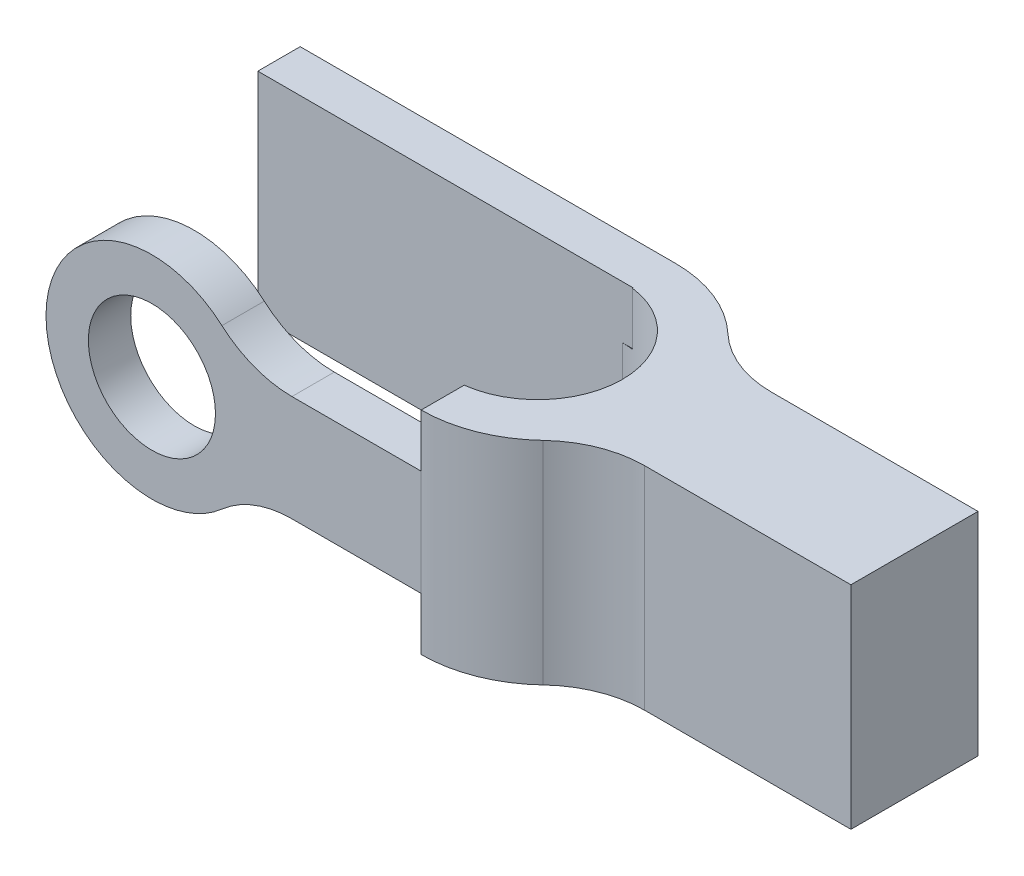
from build123d import *

# Parameters (mm, degrees)
SKETCH1_W              = 250
SKETCH1_H              = 120
BOSS_EXTRUDE1_DEPTH    = 100
CUT_EXTRUDE1_DEPTH     = 100
SKETCH5_W              = 20
SKETCH5_H              = 100
BOSS_EXTRUDE2_DEPTH    = 100
SKETCH6_W              = 20
SKETCH6_H              = 100
BOSS_EXTRUDE3_DEPTH    = 100
CUT_EXTRUDE2_START     = -100
CUT_EXTRUDE2_OUTLINE_R = 30
CUT_EXTRUDE2_DEPTH     = 100


# Read off the part's stored shape, not the designer's step: Cut-Extrude2
with BuildPart() as part:
    # Sketch1 → Boss-Extrude1 (new body)
    with BuildSketch(Plane(origin=(0, 0, 0), x_dir=(1, 0, 0), z_dir=(0, 1, 0))):
        with Locations((-125, 60)):
            Rectangle(SKETCH1_W, SKETCH1_H)
    extrude(amount=BOSS_EXTRUDE1_DEPTH)

    # Sketch2 → Cut-Extrude1 (cut)
    with BuildSketch(Plane(origin=(0, 100, 0), x_dir=(1, 0, 0), z_dir=(0, 1, 0))):
        with BuildLine():
            Line((-137.886107131, 60), (-250, 60))
            Line((-250, 60), (-250, 20))
            Line((-250, 20), (-217.607466681, 20))
            Line((-217.607466681, 20), (-177.886107131, 20))
            ThreePointArc((-177.886107131, 20), (-149.601835883, 31.715728753), (-137.886107131, 60))
        make_face()
        with BuildLine():
            Line((-250, 100), (-250, 60))
            Line((-250, 60), (-137.886107131, 60))
            ThreePointArc((-137.886107131, 60), (-149.601835883, 88.284271247), (-177.886107131, 100))
            Line((-177.886107131, 100), (-217.607466681, 100))
            Line((-217.607466681, 100), (-250, 100))
        make_face()
        with BuildLine():
            Line((0, 0), (0, 30))
            Line((0, 30), (-97.387762778, 30))
            ThreePointArc((-97.387762778, 30), (-115.851486425, 26.466018864), (-131.705192029, 16.363636364))
            ThreePointArc((-131.705192029, 16.363636364), (-150.729638754, 4.240777363), (-172.886107131, 0))
            Line((-172.886107131, 0), (0, 0))
        make_face()
        with BuildLine():
            Line((-97.387762778, 90), (0, 90))
            Line((0, 90), (0, 120))
            Line((0, 120), (-172.886107131, 120))
            ThreePointArc((-172.886107131, 120), (-150.729638754, 115.759222637), (-131.705192029, 103.636363636))
            ThreePointArc((-131.705192029, 103.636363636), (-115.851486425, 93.533981136), (-97.387762778, 90))
        make_face()
    extrude(amount=-CUT_EXTRUDE1_DEPTH, mode=Mode.SUBTRACT)

    # Sketch5 → Boss-Extrude2 (add)
    with BuildSketch(Plane.ZY.offset(250)):
        with Locations((-110, 50)):
            Rectangle(SKETCH5_W, SKETCH5_H)
    extrude(amount=BOSS_EXTRUDE2_DEPTH)

    # Sketch6 → Boss-Extrude3 (add)
    with BuildSketch(Plane.ZY.offset(250)):
        with Locations((-10, 50)):
            Rectangle(SKETCH6_W, SKETCH6_H)
    extrude(amount=BOSS_EXTRUDE3_DEPTH)

    # Cut-Extrude2 outline → Cut-Extrude2 (cut)
    with BuildSketch(Plane.XY.offset(CUT_EXTRUDE2_START)):
        with BuildLine():
            ThreePointArc((-266.908391633, 12.482609105), (-281.440890736, 3.537211244), (-298.135255344, 0))
            Line((-298.135255344, 0), (-172.886107131, 0))
            Line((-172.886107131, 0), (-172.886107131, 25))
            Line((-172.886107131, 25), (-233.816791268, 25))
            ThreePointArc((-233.816791268, 25), (-251.506753743, 21.766069191), (-266.908391633, 12.482609105))
        make_face()
        with BuildLine():
            Line((-350, 100), (-350, 50))
            ThreePointArc((-350, 50), (-320.568029043, 95.538875256), (-266.947820205, 87.482618173))
            ThreePointArc((-266.947820205, 87.482618173), (-251.561022849, 78.224637407), (-233.895648402, 75))
            Line((-233.895648402, 75), (-172.886107131, 75))
            Line((-172.886107131, 75), (-172.886107131, 100))
            Line((-172.886107131, 100), (-350, 100))
        make_face()
        with BuildLine():
            ThreePointArc((-301.864744656, 0), (-335.996534658, 15.262911764), (-350, 49.930454547))
            Line((-350, 49.930454547), (-350, 0))
            Line((-350, 0), (-301.864744656, 0))
        make_face()
        with Locations((-300, 49.965227274)):
            Circle(CUT_EXTRUDE2_OUTLINE_R)
    extrude(amount=CUT_EXTRUDE2_DEPTH, mode=Mode.SUBTRACT)


solid = part.part
